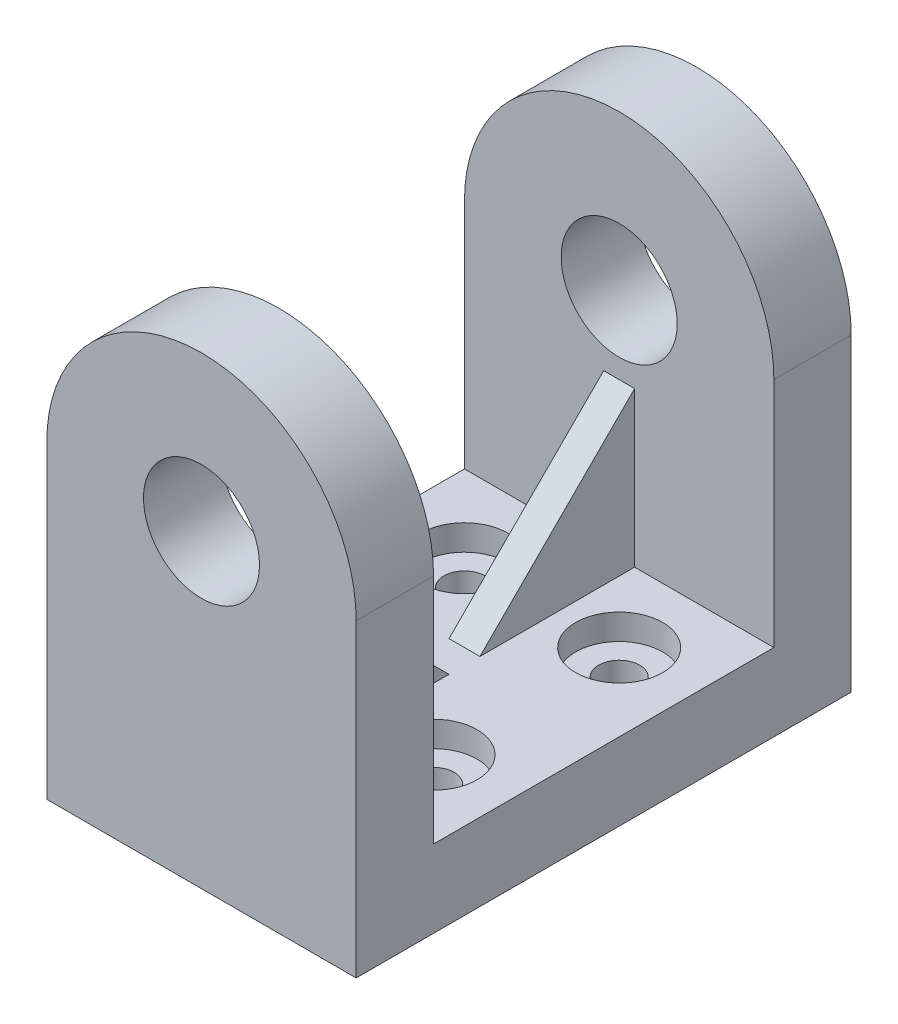
from build123d import *

# Parameters (mm, degrees)
SKETCH1_W                                      = 50.8
SKETCH1_H                                      = 12.7
BOSS_EXTRUDE1_DEPTH                            = 27.94
BOSS_EXTRUDE2_START                            = 27.94
SKETCH1_3_W                                    = 50.8
SKETCH1_3_H                                    = 12.7
BOSS_EXTRUDE2_DEPTH                            = 12.7
BOSS_EXTRUDE3_START                            = -40.64
SKETCH1_4_W                                    = 50.8
SKETCH1_4_H                                    = 12.7
BOSS_EXTRUDE3_DEPTH                            = 12.7
SKETCH2_R                                      = 9.525
CUT_EXTRUDE1_DEPTH                             = 115.271774293
RIB6_REACH                                     = 92.018
SKETCH4_WALL_W                                 = 217.956683174
SKETCH4_WALL_H                                 = 5.08
CBORE_START                                    = 8.509
CBORE_FOR_1_4_BINDING_HEAD_MACHINE_S_2_R       = 7.14375
CBORE_FOR_1_4_BINDING_HEAD_MACHINE_SCREW_DEPTH = 4.191
CBORE_FOR_1_4_BINDING_HEAD_MACHINE_S_3_O_R     = 3.3782
CBORE_FOR_1_4_BINDING_HEAD_MACHINE_S_3_DEPTH   = 8.509


# Read off the part's stored shape, not the designer's step: CBORE for 1/4 Binding Head Machine Screw1
with BuildPart() as part:
    # Sketch1 → Boss-Extrude1 (new, symmetric)
    with BuildSketch(Plane.XY):
        with Locations((0, 6.35)):
            Rectangle(SKETCH1_W, SKETCH1_H)
    extrude(amount=BOSS_EXTRUDE1_DEPTH, both=True)

    # Sketch1<3> → Boss-Extrude2 (add)
    with BuildSketch(Plane.XY.offset(BOSS_EXTRUDE2_START)):
        with BuildLine():
            Line((-25.4, 50.8), (-25.4, 12.7))
            Line((-25.4, 12.7), (25.4, 12.7))
            Line((25.4, 12.7), (25.4, 50.8))
            ThreePointArc((25.4, 50.8), (0, 76.2), (-25.4, 50.8))
        make_face()
        with Locations((0, 6.35)):
            Rectangle(SKETCH1_3_W, SKETCH1_3_H)
    extrude(amount=BOSS_EXTRUDE2_DEPTH)

    # Sketch1<4> → Boss-Extrude3 (add)
    with BuildSketch(Plane.XY.offset(BOSS_EXTRUDE3_START)):
        with BuildLine():
            Line((-25.4, 50.8), (-25.4, 12.7))
            Line((-25.4, 12.7), (25.4, 12.7))
            Line((25.4, 12.7), (25.4, 50.8))
            ThreePointArc((25.4, 50.8), (0, 76.2), (-25.4, 50.8))
        make_face()
        with Locations((0, 6.35)):
            Rectangle(SKETCH1_4_W, SKETCH1_4_H)
    extrude(amount=BOSS_EXTRUDE3_DEPTH)

    # Sketch2 → Cut-Extrude1 (cut, through all)
    with BuildSketch(Plane.XY.offset(40.64)):
        with Locations((0, 50.8)):
            Circle(SKETCH2_R)
    extrude(amount=-CUT_EXTRUDE1_DEPTH, mode=Mode.SUBTRACT)

    # Sketch4 wall → Rib6 (add, up to next)
    with BuildSketch(Plane(origin=(0, 25.4, 15.24), x_dir=(0, -0.707106781187, -0.707106781187), z_dir=(0, 0.707106781187, -0.707106781187)), mode=Mode.PRIVATE) as rib6_sk1:
        Rectangle(SKETCH4_WALL_W, SKETCH4_WALL_H)
    rib6_tool1 = extrude(rib6_sk1.sketch, amount=-RIB6_REACH, mode=Mode.PRIVATE) - part.part
    rib6 = rib6_tool1.solids().sort_by_distance((0, 25.4, 15.24))[0]
    add(rib6)

    # Mirror1: Rib6 across plane
    add(rib6.mirror(Plane.XY))

    # CBORE for 1_4 Binding Head Machine S 2 → CBORE for 1/4 Binding Head Machine Screw1 (cut)
    with BuildSketch(Plane(origin=(0, 0, 0), x_dir=(1, 0, 0), z_dir=(0, 1, 0)).offset(CBORE_START)):
        with Locations((12.7, -15.24)):
            Circle(CBORE_FOR_1_4_BINDING_HEAD_MACHINE_S_2_R)
        with Locations((12.7, 15.24)):
            Circle(CBORE_FOR_1_4_BINDING_HEAD_MACHINE_S_2_R)
        with Locations((-12.7, -15.24)):
            Circle(CBORE_FOR_1_4_BINDING_HEAD_MACHINE_S_2_R)
        with Locations((-12.7, 15.24)):
            Circle(CBORE_FOR_1_4_BINDING_HEAD_MACHINE_S_2_R)
    extrude(amount=CBORE_FOR_1_4_BINDING_HEAD_MACHINE_SCREW_DEPTH, mode=Mode.SUBTRACT)

    # CBORE for 1_4 Binding Head Machine S 3 o → CBORE for 1_4 Binding Head Machine S 3 (cut)
    with BuildSketch(Plane(origin=(0, 0, 0), x_dir=(1, 0, 0), z_dir=(0, 1, 0))):
        with Locations((12.7, -15.24)):
            Circle(CBORE_FOR_1_4_BINDING_HEAD_MACHINE_S_3_O_R)
        with Locations((12.7, 15.24)):
            Circle(CBORE_FOR_1_4_BINDING_HEAD_MACHINE_S_3_O_R)
        with Locations((-12.7, -15.24)):
            Circle(CBORE_FOR_1_4_BINDING_HEAD_MACHINE_S_3_O_R)
        with Locations((-12.7, 15.24)):
            Circle(CBORE_FOR_1_4_BINDING_HEAD_MACHINE_S_3_O_R)
    extrude(amount=CBORE_FOR_1_4_BINDING_HEAD_MACHINE_S_3_DEPTH, mode=Mode.SUBTRACT)


solid = part.part
